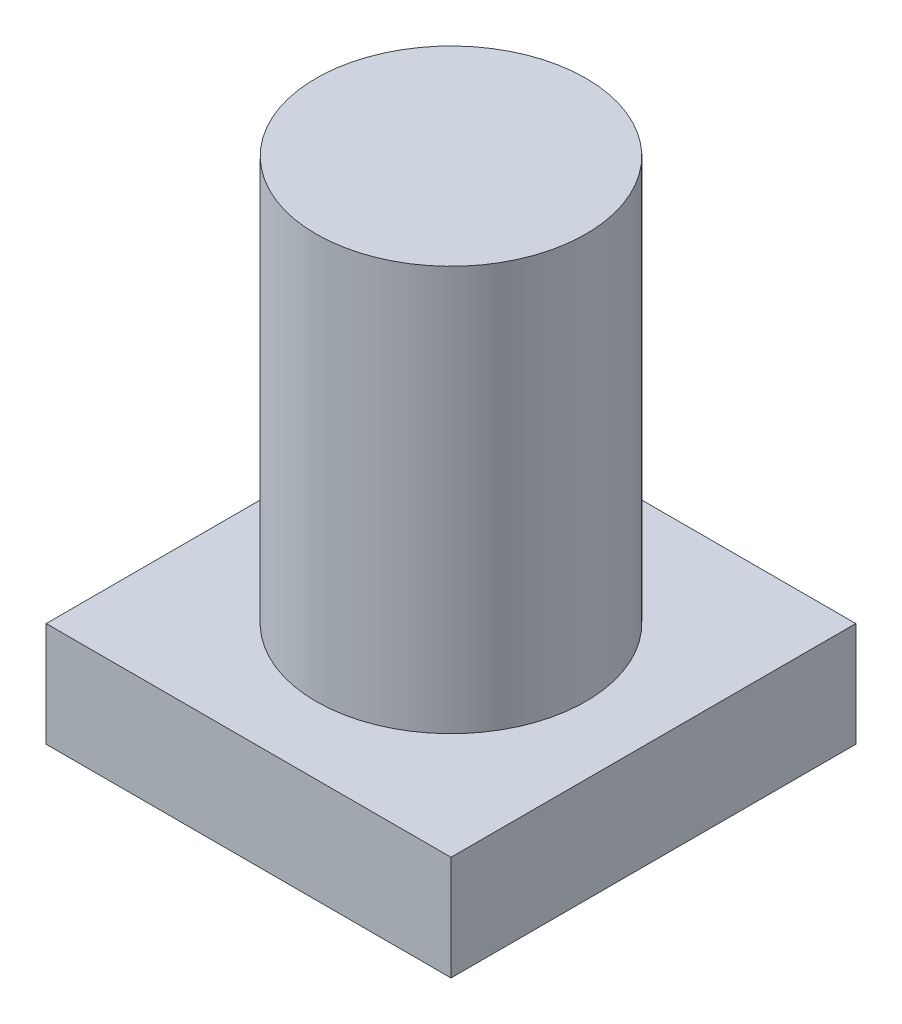
from build123d import *

# Parameters (mm, degrees)
SKETCH_1_W      = 12
SKETCH_1_H      = 12
EXTRUDE_1_DEPTH = 3.1
SKETCH_2_R      = 4
EXTRUDE_2_DEPTH = 12


with BuildPart() as part:
    # 草图1 → 拉伸1 (new body)
    with BuildSketch(Plane(origin=(0, 0, 0), x_dir=(1, 0, 0), z_dir=(0, 1, 0))):
        Rectangle(SKETCH_1_W, SKETCH_1_H)
    extrude(amount=EXTRUDE_1_DEPTH)

    # 草图2 → 拉伸2 (add)
    with BuildSketch(Plane(origin=(0, 3.1, 0), x_dir=(-1, 0, 0), z_dir=(0, 1, 0))):
        Circle(SKETCH_2_R)
    extrude(amount=EXTRUDE_2_DEPTH)


solid = part.part
